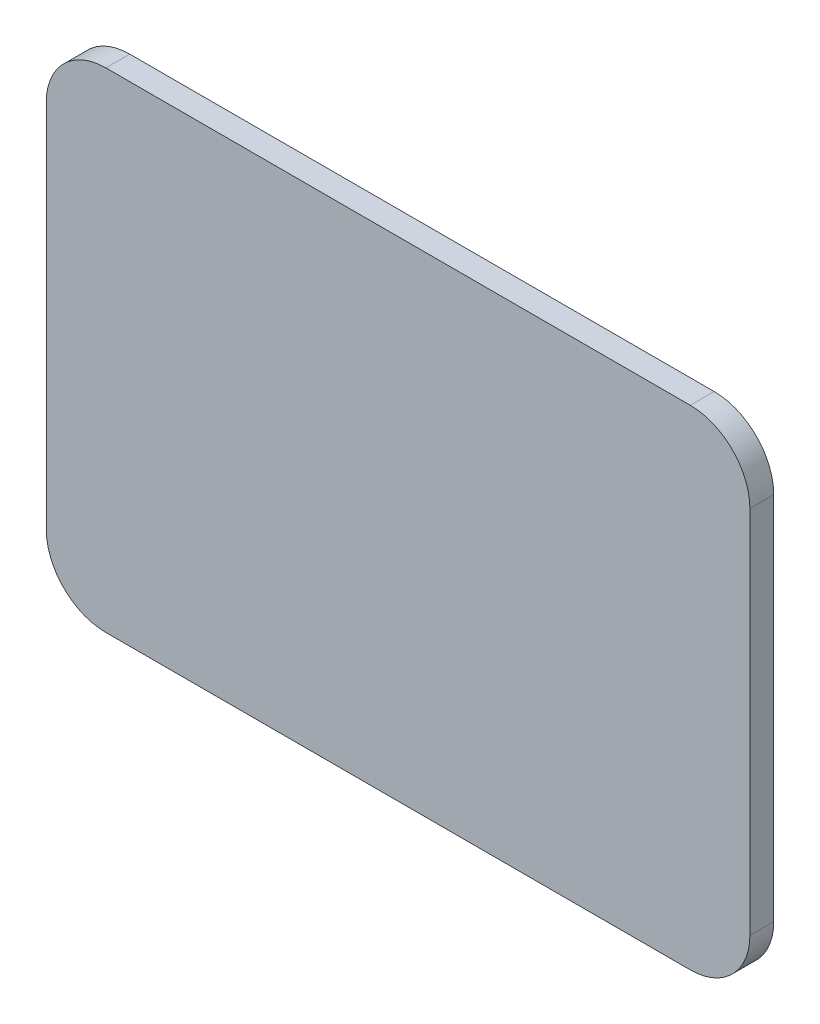
from build123d import *

# Parameters (mm, degrees)
BOSS_EXTRUDE1_DEPTH = 4


with BuildPart() as part:
    # Sketch2 → Boss-Extrude1 (new body)
    with BuildSketch(Plane.XY):
        with BuildLine():
            Line((59, -31), (59, 31))
            ThreePointArc((59, 31), (56.071067812, 38.071067812), (49, 41))
            Line((49, 41), (-49, 41))
            ThreePointArc((-49, 41), (-56.071067812, 38.071067812), (-59, 31))
            Line((-59, 31), (-59, -31))
            ThreePointArc((-59, -31), (-56.071067812, -38.071067812), (-49, -41))
            Line((-49, -41), (49, -41))
            ThreePointArc((49, -41), (56.071067812, -38.071067812), (59, -31))
        make_face()
    extrude(amount=BOSS_EXTRUDE1_DEPTH)


solid = part.part
